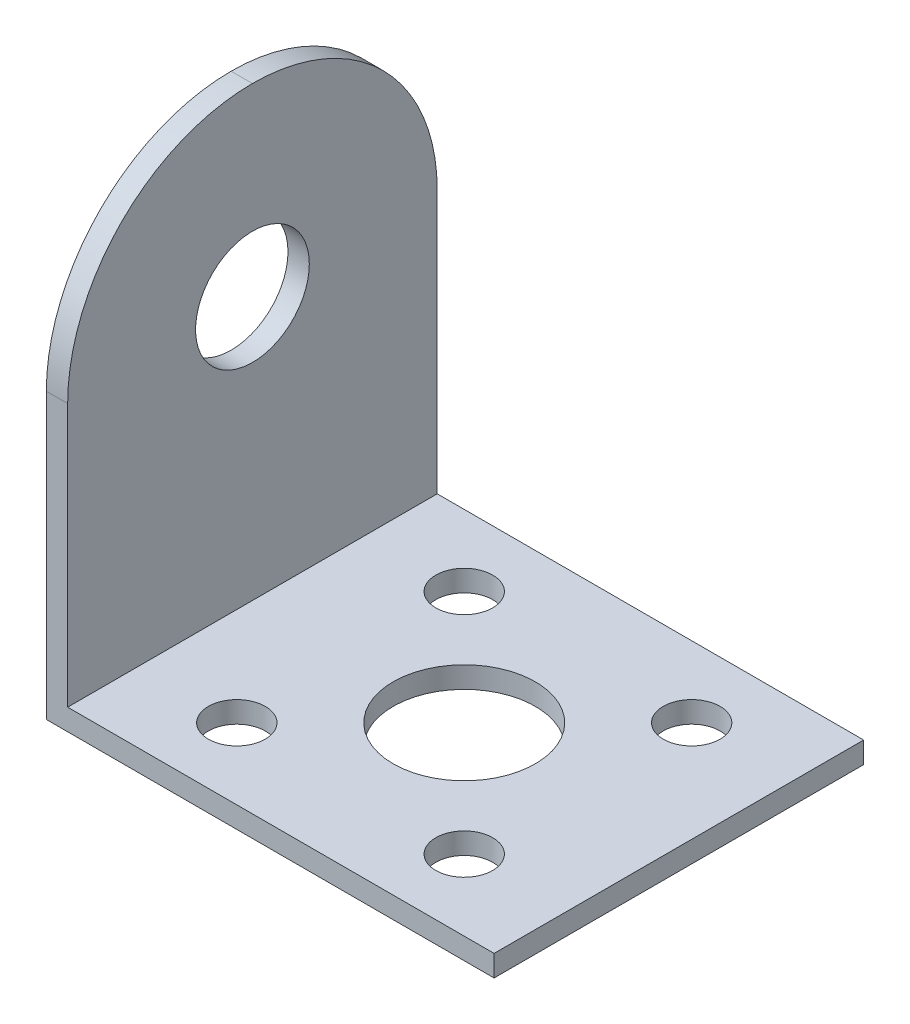
from build123d import *

# Parameters (mm, degrees)
SKETCH3_W           = 31.5
SKETCH3_H           = 26
BOSS_EXTRUDE1_DEPTH = 1.5
SKETCH4_W           = 1.5
SKETCH4_H           = 26
BOSS_EXTRUDE3_DEPTH = 31.5
FILLET3_R           = 13
FILLET4_R           = 13
SKETCH5_R           = 4
CUT_EXTRUDE1_DEPTH  = 31.5
SKETCH7_R           = 2
SKETCH7_R_2         = 5
CUT_EXTRUDE2_DEPTH  = 10


with BuildPart() as part:
    # Sketch3 → Boss-Extrude1 (new body)
    with BuildSketch(Plane(origin=(0, 0, 0), x_dir=(1, 0, 0), z_dir=(0, 1, 0))):
        Rectangle(SKETCH3_W, SKETCH3_H)
    extrude(amount=-BOSS_EXTRUDE1_DEPTH)

    # Sketch4 → Boss-Extrude3 (add)
    with BuildSketch(Plane(origin=(0, 0, 0), x_dir=(1, 0, 0), z_dir=(0, 1, 0))):
        with Locations((-15, 0)):
            Rectangle(SKETCH4_W, SKETCH4_H)
    extrude(amount=BOSS_EXTRUDE3_DEPTH)

    # Fillet3
    fillet3_edges = [part.edges().sort_by_distance(p)[0] for p in [
        (-15, 31.5, 13),
    ]]
    fillet(fillet3_edges, radius=FILLET3_R)

    # Fillet4
    fillet4_edges = [part.edges().sort_by_distance(p)[0] for p in [
        (-15, 31.5, -13),
    ]]
    fillet(fillet4_edges, radius=FILLET4_R - 0.0001)  # a hair under: the kernel refuses the full size

    # Sketch5 → Cut-Extrude1 (cut)
    with BuildSketch(Plane(origin=(-14.25, 0, 0), x_dir=(0, 0, -1), z_dir=(1, 0, 0))):
        with Locations((0, 18.5)):
            Circle(SKETCH5_R)
    extrude(amount=-CUT_EXTRUDE1_DEPTH, mode=Mode.SUBTRACT)

    # Sketch7 → Cut-Extrude2 (cut)
    with BuildSketch(Plane(origin=(0, 0, 0), x_dir=(1, 0, 0), z_dir=(0, 1, 0))):
        with Locations(Location((8.65, 8, 0), (0, 0, 270))):
            Circle(SKETCH7_R)
        with Locations(Location((8.65, -8, 0), (0, 0, 270))):
            Circle(SKETCH7_R)
        with Locations(Location((0.65, 0, 0), (0, 0, 270))):
            Circle(SKETCH7_R_2)
        with Locations(Location((-7.35, 8, 0), (0, 0, 270))):
            Circle(SKETCH7_R)
        with Locations(Location((-7.35, -8, 0), (0, 0, 270))):
            Circle(SKETCH7_R)
    extrude(amount=-CUT_EXTRUDE2_DEPTH, mode=Mode.SUBTRACT)


solid = part.part
